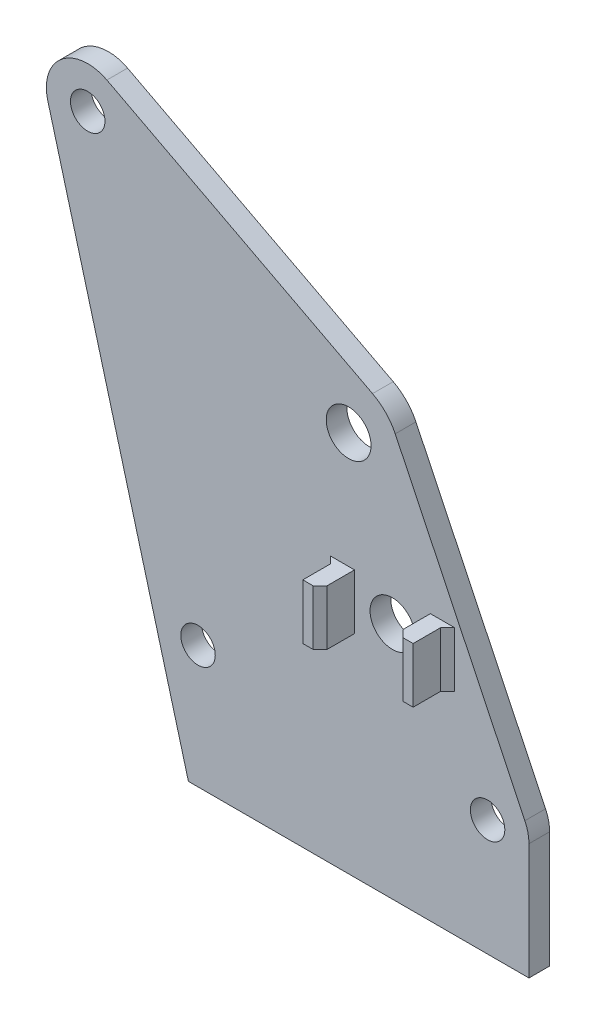
from build123d import *

# Parameters (mm, degrees)
SKETCH1_R           = 2.5
SKETCH1_R_2         = 3.25
BOSS_EXTRUDE1_DEPTH = 3
SKETCH2_W           = 2.5
SKETCH2_H           = 8
BOSS_EXTRUDE2_DEPTH = 5
CHAMFER1_SIZE       = 1


with BuildPart() as part:
    # Sketch1 → Boss-Extrude1 (new body)
    with BuildSketch(Plane.XY):
        with BuildLine():
            Line((-63.791318359, 58.43135993), (-43.395591792, -16.868352188))
            Line((-43.395591792, -16.868352188), (6, -16.868352188))
            Line((6, -16.868352188), (6, 0))
            ThreePointArc((6, 0), (5.850545761, 1.330832182), (5.409628568, 2.595364861))
            Line((5.409628568, 2.595364861), (-13.395576429, 41.791847675))
            ThreePointArc((-13.395576429, 41.791847675), (-14.765199318, 43.760307326), (-16.686113759, 45.195851809))
            Line((-16.686113759, 45.195851809), (-55.222801296, 65.318568168))
            ThreePointArc((-55.222801296, 65.318568168), (-61.758941161, 64.676575814), (-63.791318359, 58.43135993))
        make_face()
        Circle(SKETCH1_R, mode=Mode.SUBTRACT)
        with Locations((-58, 60)):
            Circle(SKETCH1_R, mode=Mode.SUBTRACT)
        with Locations((-42, 0.929027955)):
            Circle(SKETCH1_R, mode=Mode.SUBTRACT)
        with Locations((-20.157612139, 38.547641599)):
            Circle(SKETCH1_R_2, mode=Mode.SUBTRACT)
        with Locations((-13.798527561, 17.748013157)):
            Circle(SKETCH1_R_2, mode=Mode.SUBTRACT)
    extrude(amount=BOSS_EXTRUDE1_DEPTH)

    # Sketch2 → Boss-Extrude2 (add)
    with BuildSketch(Plane.XY.offset(3)):
        with Locations((-7.048527561, 17.748013157)):
            Rectangle(SKETCH2_W, SKETCH2_H)
        with Locations((-20.548527561, 17.748013157)):
            Rectangle(SKETCH2_W, SKETCH2_H)
    extrude(amount=BOSS_EXTRUDE2_DEPTH)

    # Chamfer1
    chamfer1_edges = [part.edges().sort_by_distance(p)[0] for p in [
        (-19.298527561, 17.748013157, 8),
        (-8.298527561, 17.748013157, 8),
        (-21.798527561, 17.748013157, 3),
        (-5.798527561, 17.748013157, 3),
    ]]
    chamfer(chamfer1_edges, length=CHAMFER1_SIZE)


solid = part.part
